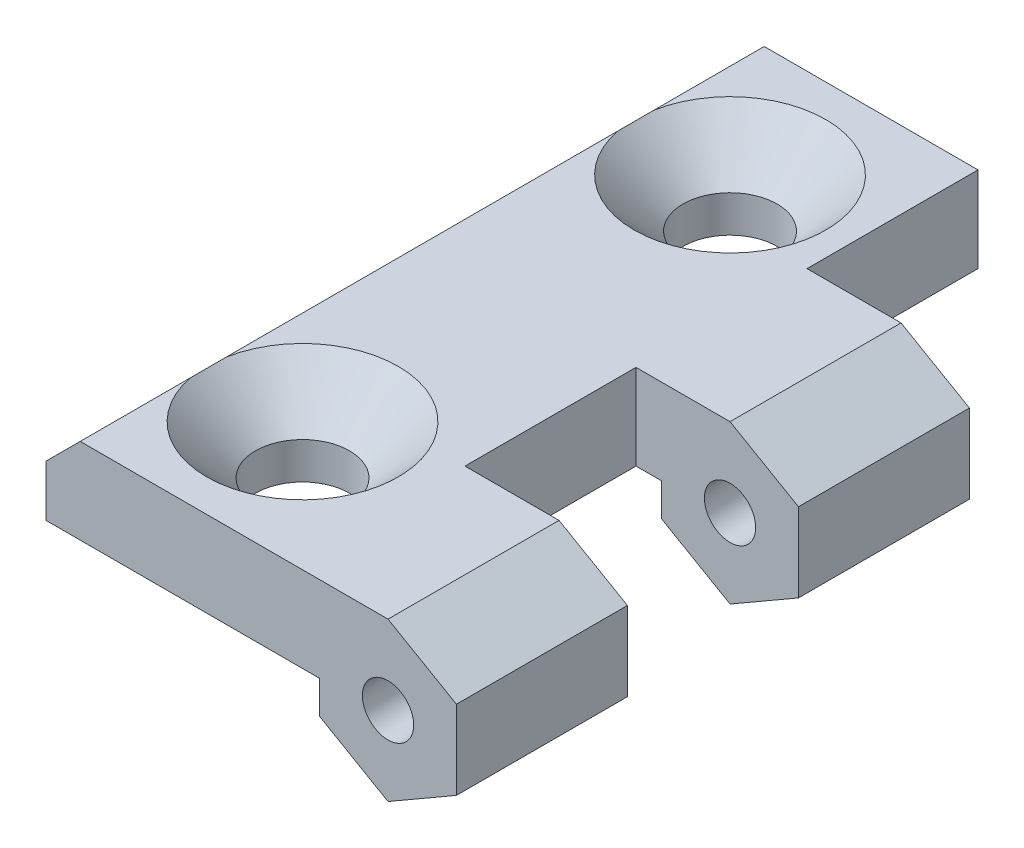
from build123d import *

# Parameters (mm, degrees)
EXTRUDE_1_DEPTH              = 10
SKETCH_2_W                   = 16
SKETCH_2_H                   = 6.92820323
EXTRUDE_2_DEPTH              = 10
SKETCH_3_W                   = 10
SKETCH_3_H                   = 6.92820323
CUT_EXTRUDE_1_DEPTH          = 1.5
CUT_EXTRUDE_2_DEPTH          = 1.92820323
EXTRUDE_3_DEPTH              = 10
SKETCH_6_W                   = 14.5
SKETCH_6_H                   = 5
EXTRUDE_4_DEPTH              = 10
HOLE_WIZARD_3_0_3_1_D        = 3
HOLE_WIZARD_3_0_3_1_DEPTH    = 10
HOLE_WIZARD_M5_1_D           = 5.5
HOLE_WIZARD_M5_1_DEPTH       = 9.237604307
HOLE_WIZARD_M5_1_CSINK_D     = 11.2
HOLE_WIZARD_M5_1_CSINK_ANGLE = 90
HOLE_WIZARD_3_0_3_2_D        = 3
HOLE_WIZARD_3_0_3_2_DEPTH    = 30
CHAMFER_1_SIZE               = 2


with BuildPart() as part:
    # 草图1 → 凸台-拉伸1 (new body)
    with BuildSketch(Plane.XY):
        Polygon((10, 5), (-10, 5), (-10, -1.92820323), (6, -1.92820323), (10, -4.237604307), (14, -1.92820323), (14, 2.690598923), align=None)
    extrude(amount=-EXTRUDE_1_DEPTH)

    # 草图2 → 凸台-拉伸2 (add)
    with BuildSketch(Plane.XY):
        with Locations((-2, 1.535898385)):
            Rectangle(SKETCH_2_W, SKETCH_2_H)
    extrude(amount=EXTRUDE_2_DEPTH)

    # 草图3 → 切除-拉伸1 (cut)
    with BuildSketch(Plane(origin=(6, 0, 0), x_dir=(0, 0, -1), z_dir=(1, 0, 0))):
        with Locations((-5, 1.535898385)):
            Rectangle(SKETCH_3_W, SKETCH_3_H)
    extrude(amount=-CUT_EXTRUDE_1_DEPTH, mode=Mode.SUBTRACT)

    # 草图4 → 切除-拉伸2 (cut)
    with BuildSketch(Plane.XZ.offset(1.92820323)):
        Polygon((4.5, 0), (4.5, 10), (-10, 10), (-10, -10), (6, -10), (6, 0), align=None)
    extrude(amount=-CUT_EXTRUDE_2_DEPTH, mode=Mode.SUBTRACT)

    # 草图5 → 凸台-拉伸3 (add)
    with BuildSketch(Plane.XY.offset(10)):
        Polygon((-10, 5), (10, 5), (14, 2.690598923), (14, -1.92820323), (10, -4.237604307), (6, -1.92820323), (6, 0), (-10, 0), align=None)
    extrude(amount=EXTRUDE_3_DEPTH)

    # 草图6 → 凸台-拉伸4 (add)
    with BuildSketch(Plane(origin=(0, 0, -10), x_dir=(-1, 0, 0), z_dir=(0, 0, -1))):
        with Locations((2.75, 2.5)):
            Rectangle(SKETCH_6_W, SKETCH_6_H)
    extrude(amount=EXTRUDE_4_DEPTH)

    # Ø3.0 (3) 直径孔1
    with Locations(Plane(origin=(0, 0, 10), x_dir=(-1, 0, 0), z_dir=(0, 0, -1))):
        with Locations((-10, 0.381197846)):
            Hole(HOLE_WIZARD_3_0_3_1_D / 2, depth=HOLE_WIZARD_3_0_3_1_DEPTH)

    # M5 平头机械螺钉的锥形沉头孔1
    with Locations(Plane(origin=(0, 5, 0), x_dir=(1, 0, 0), z_dir=(0, 1, 0))):
        with Locations((-2.5, 12.5), (-2.5, -12.5)):
            CounterSinkHole(HOLE_WIZARD_M5_1_D / 2, HOLE_WIZARD_M5_1_CSINK_D / 2, depth=HOLE_WIZARD_M5_1_DEPTH, counter_sink_angle=HOLE_WIZARD_M5_1_CSINK_ANGLE)

    # Ø3.0 (3) 直径孔2
    with Locations(Plane(origin=(0, 0, -10), x_dir=(-1, 0, 0), z_dir=(0, 0, -1))):
        with Locations((-10, 0.381197846)):
            Hole(HOLE_WIZARD_3_0_3_2_D / 2, depth=HOLE_WIZARD_3_0_3_2_DEPTH)

    # 倒角1
    # the kernel refuses this chamfer: 2 mm, written as the material it takes off along each edge
    with BuildSketch(Plane(origin=(-10, 5, -25.143365976), x_dir=(0.9996219169112968, 0.027495876610586487, 0), z_dir=(0, 0, 1))) as chamfer_1_piece_1:
        Polygon((CHAMFER_1_SIZE * 0.999621916911, -CHAMFER_1_SIZE * 0.0274958766106), (-CHAMFER_1_SIZE * 0.0274958766106, -CHAMFER_1_SIZE * 0.999621916911), (0, 0), align=None)
    extrude(amount=50.286731952, mode=Mode.SUBTRACT)


solid = part.part
